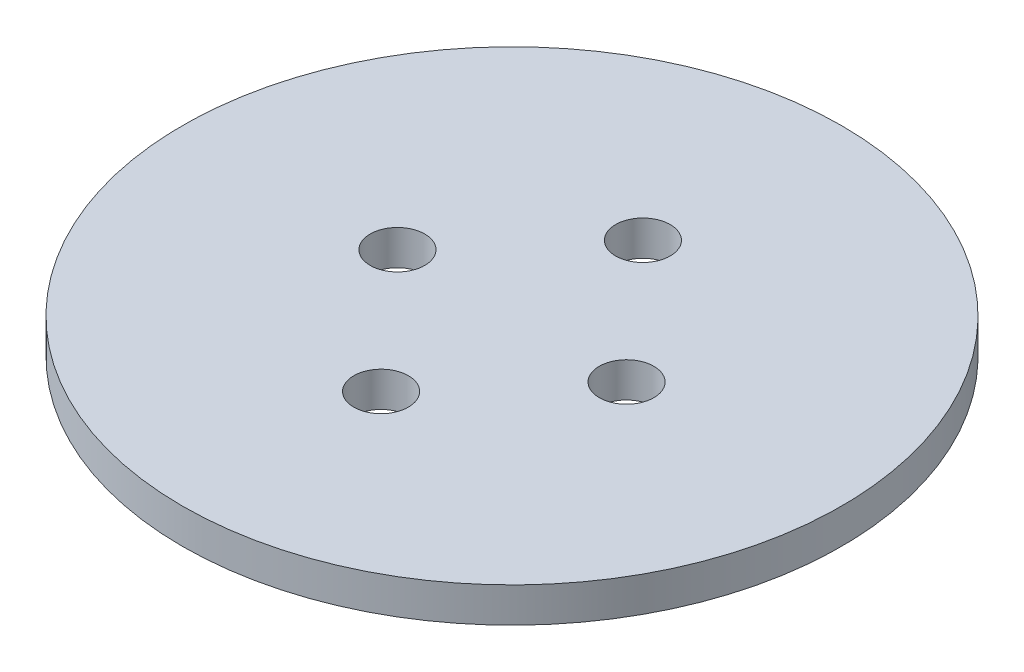
from build123d import *

# Parameters (mm, degrees)
SKETCH1_R            = 47.9552
BOSS_EXTRUDE1_DEPTH  = 5.08
U_BOLT_HOLES_D       = 7.9375
THREADED_ROD_HOLES_D = 7.9375


with BuildPart() as part:
    # Sketch1 → Boss-Extrude1 (new body)
    with BuildSketch(Plane(origin=(0, 0, 0), x_dir=(1, 0, 0), z_dir=(0, 1, 0))):
        Circle(SKETCH1_R)
    extrude(amount=BOSS_EXTRUDE1_DEPTH)

    # U-bolt Holes (through all)
    with Locations(Plane(origin=(0, 5.08, 0), x_dir=(1, 0, 0), z_dir=(0, 1, 0))):
        with Locations((-16.66875, 0), (16.66875, 0)):
            Hole(U_BOLT_HOLES_D / 2)

    # Threaded Rod Holes (through all)
    with Locations(Plane(origin=(0, 5.08, 0), x_dir=(1, 0, 0), z_dir=(0, 1, 0))):
        with Locations((0, 19.05), (0, -19.05)):
            Hole(THREADED_ROD_HOLES_D / 2)


solid = part.part
